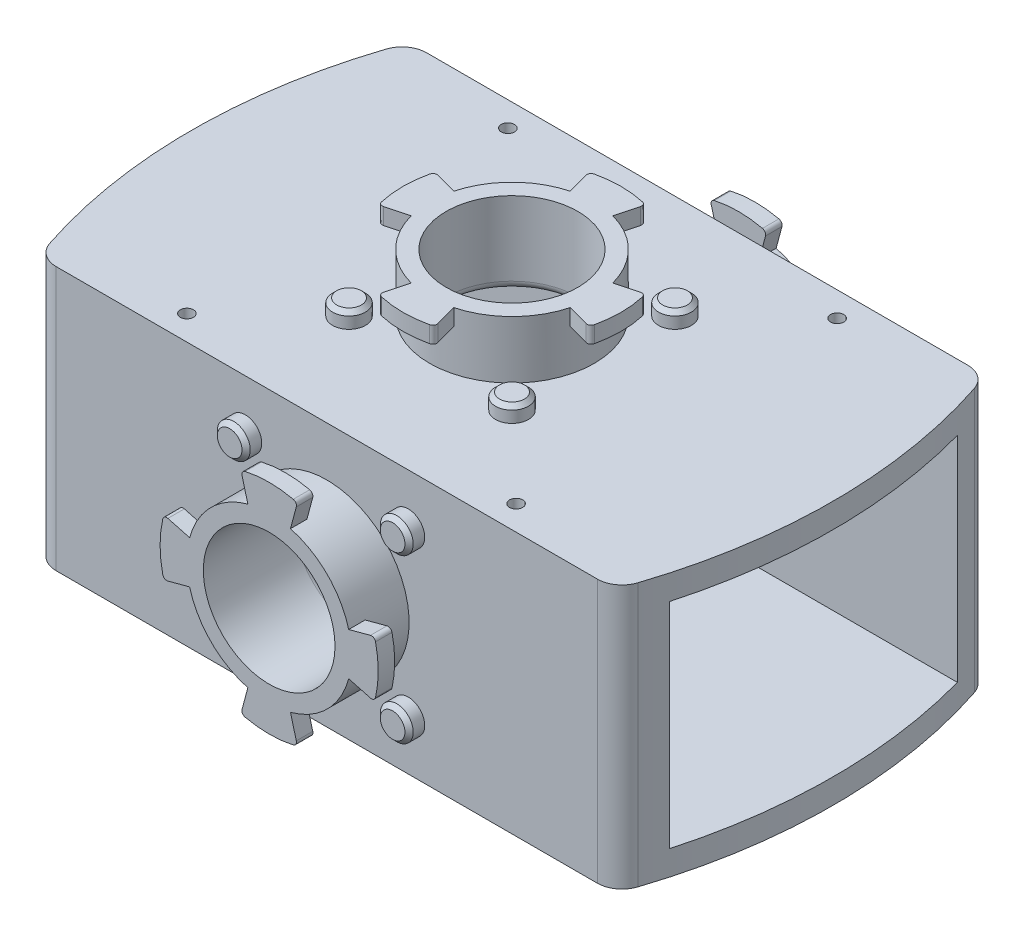
from build123d import *
from build123d.topology import SkipClean

# Parameters (mm, degrees)
EXTRUDE_1_DEPTH                      = 16
SKETCH_3_R                           = 10.000000000000004
SKETCH_3_R_2                         = 8
EXTRUDE_2_DEPTH                      = 7
EXTRUDE_START                        = -2
EXTRUDE_3_DEPTH                      = 2
FILLET_1_R                           = 0.5
PATTERN_CIRCULAR_1_COUNT             = 4
FILLET_1_OF_PATTERN_CIRCULAR_1_R     = 0.5
SKETCH_5_R                           = 1.9999999999999996
EXTRUDE_4_DEPTH                      = 1.9
CHAMFER_1_SIZE                       = 0.5
PATTERN_CIRCULAR_2_COUNT             = 4
CHAMFER_1_OF_PATTERN_CIRCULAR_2_SIZE = 0.5
CUT_EXTRUDE_1_DEPTH                  = 75
MIRROR_START                         = -23
MIRROR_1_OUTLINE_R                   = 10
MIRROR_1_OUTLINE_R_2                 = 8
MIRROR_1_DEPTH                       = 7
MIRROR_1_2_DEPTH                     = 2
CUT_EXTRUDE_START                    = -39
CUT_EXTRUDE_2_OUTLINE_R              = 8
CUT_EXTRUDE_2_DEPTH                  = 32
SKETCH_6_R                           = 10
SKETCH_6_R_2                         = 8
EXTRUDE_5_DEPTH                      = 7
EXTRUDE_6_DEPTH                      = 2
FILLET_2_R                           = 0.5
SKETCH_8_R                           = 2.0000000000000013
EXTRUDE_7_DEPTH                      = 1.9
CHAMFER_2_SIZE                       = 0.5
PATTERN_CIRCULAR_3_COUNT             = 4
FILLET_2_OF_PATTERN_CIRCULAR_3_R     = 0.5
CHAMFER_2_OF_PATTERN_CIRCULAR_3_SIZE = 0.5
MIRROR_START_2                       = -29.5
MIRROR_2_OUTLINE_R                   = 10
MIRROR_2_OUTLINE_R_2                 = 8
MIRROR_2_DEPTH                       = 7.5
MIRROR_2_2_DEPTH                     = 2
FILLET_3_R                           = 3
SKETCH_11_R                          = 8
CUT_EXTRUDE_3_DEPTH                  = 59


with BuildPart() as part:
    # ｽｹｯﾁ2 → ﾎﾞｽ - 押し出し1 (new, symmetric)
    with BuildSketch(Plane(origin=(0, 0, 0), x_dir=(1, 0, 0), z_dir=(0, 1, 0))):
        with BuildLine():
            Line((-35.00000000000001, 22.5), (34.99999999999999, 22.5))
            ThreePointArc((34.99999999999999, 22.5), (39, 0), (34.99999999999999, -22.5))
            Line((34.99999999999999, -22.5), (-35.00000000000001, -22.5))
            ThreePointArc((-35.00000000000001, -22.5), (-39.00000000000001, 7.99e-15), (-35.00000000000001, 22.5))
        make_face()
    extrude(amount=EXTRUDE_1_DEPTH, both=True)

    # ｽｹｯﾁ3 → ﾎﾞｽ - 押し出し2 (add)
    with BuildSketch(Plane(origin=(0, 16, 0), x_dir=(1, 0, 0), z_dir=(0, 1, 0))):
        with Locations(Location((0, 0, 0), (0, 0, 270))):
            Circle(SKETCH_3_R)
        with Locations(Location((0, 0, 0), (0, 0, 270))):
            Circle(SKETCH_3_R_2, mode=Mode.SUBTRACT)
    extrude(amount=EXTRUDE_2_DEPTH)

    # ｽｹｯﾁ4 → ﾎﾞｽ - 押し出し3 (add)
    with BuildSketch(Plane(origin=(0, 23, 0), x_dir=(1, 0, 0), z_dir=(0, 1, 0)).offset(EXTRUDE_START)):
        with BuildLine():
            Line((-3.4293523476083645, 12.798517198330163), (-2.5881904510251803, 9.659258262890692))
            ThreePointArc((-2.5881904510251803, 9.659258262890692), (-1.67e-15, 10.000000000000002), (2.588190451025177, 9.659258262890695))
            Line((2.588190451025176, 9.659258262890694), (3.4293523476083583, 12.798517198330167))
            ThreePointArc((3.429352347608359, 12.798517198330167), (-3.22e-15, 13.249999999999998), (-3.4293523476083645, 12.798517198330163))
        make_face()
    extrude_3 = extrude(amount=EXTRUDE_3_DEPTH)

    # ﾌｨﾚｯﾄ1
    fillet_1_edges = [part.edges().sort_by_distance(p)[0] for p in [
        (-3.429352347608364, 22, -12.798517198330163),
        (3.4293523476083583, 22, -12.798517198330167),
    ]]
    fillet(fillet_1_edges, radius=FILLET_1_R)

    # 円形ﾊﾟﾀｰﾝ1: ﾎﾞｽ - 押し出し3 ×4 about axis
    pattern_circular_1_axis = Axis((9.84e-15, 0, 8e-17), (0, 1, 0))
    for i in range(1, PATTERN_CIRCULAR_1_COUNT):
        add(extrude_3.rotate(pattern_circular_1_axis, i * 360 / PATTERN_CIRCULAR_1_COUNT))

    # ﾌｨﾚｯﾄ1 of 円形ﾊﾟﾀｰﾝ1
    fillet_1_of_pattern_circular_1_edges = [part.edges().sort_by_distance(p)[0] for p in [
        (-12.798517198330154, 22, 3.429352347608373),
        (-12.798517198330158, 22, -3.4293523476083494),
        (3.429352347608382, 22, 12.798517198330163),
        (-3.4293523476083405, 22, 12.798517198330167),
        (12.798517198330174, 22, -3.4293523476083716),
        (12.798517198330178, 22, 3.4293523476083507),
    ]]
    fillet(fillet_1_of_pattern_circular_1_edges, radius=FILLET_1_OF_PATTERN_CIRCULAR_1_R)

    # ｽｹｯﾁ5 → ﾎﾞｽ - 押し出し4 (add)
    with BuildSketch(Plane(origin=(0, 16, 0), x_dir=(1, 0, 0), z_dir=(0, 1, 0))):
        with Locations(Location((-9.89949493661165, 9.899494936611681, 0), (0, 0, 90))):
            Circle(SKETCH_5_R)
    extrude_4 = extrude(amount=EXTRUDE_4_DEPTH)

    # 面取り1
    chamfer_1_edges = [part.edges().sort_by_distance(p)[0] for p in [
        (-9.89949493661165, 17.9, -7.899494936611681),
    ]]
    chamfer(chamfer_1_edges, length=CHAMFER_1_SIZE)

    # 円形ﾊﾟﾀｰﾝ2: ﾎﾞｽ - 押し出し4 ×4 about axis
    pattern_circular_2_axis = Axis((-1.735e-14, 0, 1.735e-14), (0, 1, 0))
    for i in range(1, PATTERN_CIRCULAR_2_COUNT):
        add(extrude_4.rotate(pattern_circular_2_axis, i * 360 / PATTERN_CIRCULAR_2_COUNT))

    # 面取り1 of 円形ﾊﾟﾀｰﾝ2
    chamfer_1_of_pattern_circular_2_edges = [part.edges().sort_by_distance(p)[0] for p in [
        (-7.899494936611717, 17.9, 9.89949493661165),
        (9.899494936611612, 17.9, 7.899494936611717),
        (7.899494936611683, 17.9, -9.899494936611612),
    ]]
    chamfer(chamfer_1_of_pattern_circular_2_edges, length=CHAMFER_1_OF_PATTERN_CIRCULAR_2_SIZE)

    # ｽｹｯﾁ9 → ｶｯﾄ - 押し出し1 (cut, symmetric)
    with BuildSketch(Plane(origin=(0, 0, 0), x_dir=(0, 0, -1), z_dir=(1, 0, 0))):
        Polygon((17.5, -13.000000000000002), (-17.5, -13.000000000000005), (-17.5, 12.999999999999995), (17.5, 12.999999999999998), align=None)
    extrude(amount=CUT_EXTRUDE_1_DEPTH, both=True, mode=Mode.SUBTRACT)

    # ﾐﾗｰ1: read off the stored shape, not the designer's step
    # ﾐﾗｰ1 outline → ﾐﾗｰ1 (add)
    with BuildSketch(Plane(origin=(0, 0, 0), x_dir=(1, 0, 0), z_dir=(0, 1, 0)).offset(MIRROR_START)):
        Circle(MIRROR_1_OUTLINE_R)
        Circle(MIRROR_1_OUTLINE_R_2, mode=Mode.SUBTRACT)
    extrude(amount=MIRROR_1_DEPTH)

    # Mirror 1 2 outline → Mirror 1 2 (add)
    with BuildSketch(Plane(origin=(0, 0, 0), x_dir=(1, 0, 0), z_dir=(0, 1, 0)).offset(MIRROR_START)):
        with BuildLine():
            ThreePointArc((9.659258263, 2.588190451), (10, 0), (9.659258263, -2.588190451))
            Line((9.659258263, -2.588190451), (12.30608078, -3.297404407))
            ThreePointArc((12.30608078, -3.297404407), (12.693934299, -3.242468012), (12.923156589, -2.924811749))
            ThreePointArc((12.923156589, -2.924811749), (13.25, 0), (12.923156589, 2.924811749))
            ThreePointArc((12.923156589, 2.924811749), (12.693934299, 3.242468012), (12.30608078, 3.297404407))
            Line((12.30608078, 3.297404407), (9.659258263, 2.588190451))
        make_face()
        with BuildLine():
            ThreePointArc((-2.588190451, 9.659258263), (0, 10), (2.588190451, 9.659258263))
            Line((2.588190451, 9.659258263), (3.297404407, 12.30608078))
            ThreePointArc((3.297404407, 12.30608078), (3.242468012, 12.693934299), (2.924811749, 12.923156589))
            ThreePointArc((2.924811749, 12.923156589), (0, 13.25), (-2.924811749, 12.923156589))
            ThreePointArc((-2.924811749, 12.923156589), (-3.242468012, 12.693934299), (-3.297404407, 12.30608078))
            Line((-3.297404407, 12.30608078), (-2.588190451, 9.659258263))
        make_face()
        with BuildLine():
            Line((3.297404407, -12.30608078), (2.588190451, -9.659258263))
            ThreePointArc((2.588190451, -9.659258263), (0, -10), (-2.588190451, -9.659258263))
            Line((-2.588190451, -9.659258263), (-3.297404407, -12.30608078))
            ThreePointArc((-3.297404407, -12.30608078), (-3.242468012, -12.693934299), (-2.924811749, -12.923156589))
            ThreePointArc((-2.924811749, -12.923156589), (0, -13.25), (2.924811749, -12.923156589))
            ThreePointArc((2.924811749, -12.923156589), (3.242468012, -12.693934299), (3.297404407, -12.30608078))
        make_face()
        with BuildLine():
            ThreePointArc((-9.659258263, -2.588190451), (-10, 0), (-9.659258263, 2.588190451))
            Line((-9.659258263, 2.588190451), (-12.30608078, 3.297404407))
            ThreePointArc((-12.30608078, 3.297404407), (-12.693934299, 3.242468012), (-12.923156589, 2.924811749))
            ThreePointArc((-12.923156589, 2.924811749), (-13.25, 0), (-12.923156589, -2.924811749))
            ThreePointArc((-12.923156589, -2.924811749), (-12.693934299, -3.242468012), (-12.30608078, -3.297404407))
            Line((-12.30608078, -3.297404407), (-9.659258263, -2.588190451))
        make_face()
    extrude(amount=MIRROR_1_2_DEPTH)

    # Mirror 1 3 outline → Mirror 1 3 (revolve)
    with BuildSketch(Plane(origin=(-9.899494937, 0, -9.899494937), x_dir=(1, 0, 0), z_dir=(0, 0, 1))):
        Polygon((1.5, -17.9), (2, -17.4), (2, -16), (0, -16), (0, -17.9), align=None)
    revolve(axis=Axis((-9.899494937, 0, -9.899494937), (0, 1, 0)))

    # Mirror 1 4 outline → Mirror 1 4 (revolve)
    with BuildSketch(Plane(origin=(-9.899494937, 0, 9.899494937), x_dir=(1, 0, 0), z_dir=(0, 0, 1))):
        Polygon((1.5, -17.9), (2, -17.4), (2, -16), (0, -16), (0, -17.9), align=None)
    revolve(axis=Axis((-9.899494937, 0, 9.899494937), (0, 1, 0)))

    # Mirror 1 5 outline → Mirror 1 5 (revolve)
    with BuildSketch(Plane(origin=(9.899494937, 0, 9.899494937), x_dir=(1, 0, 0), z_dir=(0, 0, 1))):
        Polygon((1.5, -17.9), (2, -17.4), (2, -16), (0, -16), (0, -17.9), align=None)
    revolve(axis=Axis((9.899494937, 0, 9.899494937), (0, 1, 0)))

    # Mirror 1 6 outline → Mirror 1 6 (revolve)
    with BuildSketch(Plane(origin=(9.899494937, 0, -9.899494937), x_dir=(1, 0, 0), z_dir=(0, 0, 1))):
        Polygon((1.5, -17.9), (2, -17.4), (2, -16), (0, -16), (0, -17.9), align=None)
    revolve(axis=Axis((9.899494937, 0, -9.899494937), (0, 1, 0)))

    # ｶｯﾄ - 押し出し2: read off the stored shape, not the designer's step
    # ｶｯﾄ - 押し出し2 outline → ｶｯﾄ - 押し出し2 (cut)
    with BuildSketch(Plane(origin=(0, 23, 0), x_dir=(1, 0, 0), z_dir=(0, 1, 0)).offset(CUT_EXTRUDE_START)):
        Circle(CUT_EXTRUDE_2_OUTLINE_R)
    extrude(amount=CUT_EXTRUDE_2_DEPTH, mode=Mode.SUBTRACT)

    # ｽｹｯﾁ6 → ﾎﾞｽ - 押し出し5 (add)
    with BuildSketch(Plane.XY.offset(22.5)):
        with Locations(Location((0, 0, 0), (0, 0, 180))):
            Circle(SKETCH_6_R)
        Circle(SKETCH_6_R_2, mode=Mode.SUBTRACT)
    extrude(amount=EXTRUDE_5_DEPTH)

    # ｽｹｯﾁ7 → ﾎﾞｽ - 押し出し6 (add)
    with BuildSketch(Plane.XY.offset(29.5).offset(EXTRUDE_START)):
        with BuildLine():
            Line((-3.429352347608455, 12.798517198330138), (-2.070552360820199, 7.727406610312537))
            ThreePointArc((-2.070552360820199, 7.727406610312537), (-5.991e-14, 7.999999999999999), (2.0705523608200846, 7.727406610312568))
            Line((2.0705523608200846, 7.727406610312568), (3.4293523476082672, 12.798517198330192))
            ThreePointArc((3.4293523476082672, 12.798517198330192), (-9.922e-14, 13.249999999999998), (-3.429352347608455, 12.798517198330138))
        make_face()
    extrude_6 = extrude(amount=EXTRUDE_6_DEPTH)

    # ﾌｨﾚｯﾄ2
    fillet_2_edges = [part.edges().sort_by_distance(p)[0] for p in [
        (3.4293523476082672, 12.798517198330192, 28.5),
        (-3.4293523476084555, 12.798517198330138, 28.5),
    ]]
    fillet(fillet_2_edges, radius=FILLET_2_R)

    # ｽｹｯﾁ8 → ﾎﾞｽ - 押し出し7 (add)
    with BuildSketch(Plane.XY.offset(22.5)):
        with Locations(Location((-9.899494936611719, 9.89949493661161, 0), (0, 0, 180))):
            Circle(SKETCH_8_R)
    extrude_7 = extrude(amount=EXTRUDE_7_DEPTH)

    # 面取り2
    chamfer_2_edges = [part.edges().sort_by_distance(p)[0] for p in [
        (-7.899494936611717, 9.89949493661161, 24.4),
    ]]
    chamfer(chamfer_2_edges, length=CHAMFER_2_SIZE)

    # 円形ﾊﾟﾀｰﾝ3: ﾎﾞｽ - 押し出し6, ﾎﾞｽ - 押し出し7 ×4 about axis
    with SkipClean():  # the faces are left unmerged after this step: merging them gives an invalid solid
        pattern_circular_3_axis = Axis((-1.211e-14, -6.29e-15, 0), (0, 0, 1))
        add([extrude_6.rotate(pattern_circular_3_axis, i * 360 / PATTERN_CIRCULAR_3_COUNT) for i in range(1, PATTERN_CIRCULAR_3_COUNT)])
        add([extrude_7.rotate(pattern_circular_3_axis, i * 360 / PATTERN_CIRCULAR_3_COUNT) for i in range(1, PATTERN_CIRCULAR_3_COUNT)])

    # ﾌｨﾚｯﾄ2 of 円形ﾊﾟﾀｰﾝ3
    fillet_2_of_pattern_circular_3_edges = [part.edges().sort_by_distance(p)[0] for p in [
        (-12.79851719833021, 3.429352347608274, 28.5),
        (-12.798517198330156, -3.429352347608449, 28.5),
        (-3.4293523476082934, -12.798517198330204, 28.5),
        (3.4293523476084293, -12.798517198330151, 28.5),
        (12.798517198330186, -3.4293523476082877, 28.5),
        (12.798517198330133, 3.429352347608435, 28.5),
    ]]
    fillet(fillet_2_of_pattern_circular_3_edges, radius=FILLET_2_OF_PATTERN_CIRCULAR_3_R)

    # 面取り2 of 円形ﾊﾟﾀｰﾝ3
    chamfer_2_of_pattern_circular_3_edges = [part.edges().sort_by_distance(p)[0] for p in [
        (-9.899494936611628, -7.89949493661171, 24.4),
        (7.899494936611692, -9.899494936611624, 24.4),
        (9.899494936611607, 7.899494936611696, 24.4),
    ]]
    chamfer(chamfer_2_of_pattern_circular_3_edges, length=CHAMFER_2_OF_PATTERN_CIRCULAR_3_SIZE)

    # ﾐﾗｰ2: read off the stored shape, not the designer's step
    # ﾐﾗｰ2 outline → ﾐﾗｰ2 (add)
    with SkipClean():  # the faces are left unmerged after this step: merging them gives an invalid solid
        with BuildSketch(Plane.XY.offset(MIRROR_START_2)):
            Circle(MIRROR_2_OUTLINE_R)
            Circle(MIRROR_2_OUTLINE_R_2, mode=Mode.SUBTRACT)
        extrude(amount=MIRROR_2_DEPTH)

    # Mirror 2 2 outline → Mirror 2 2 (add)
    with SkipClean():  # the faces are left unmerged after this step: merging them gives an invalid solid
        with BuildSketch(Plane.XY.offset(MIRROR_START_2)):
            with BuildLine():
                ThreePointArc((9.659258263, 2.588190451), (10, 0), (9.659258263, -2.588190451))
                Line((9.659258263, -2.588190451), (12.30608078, -3.297404407))
                ThreePointArc((12.30608078, -3.297404407), (12.693934299, -3.242468012), (12.923156589, -2.924811749))
                ThreePointArc((12.923156589, -2.924811749), (13.25, 0), (12.923156589, 2.924811749))
                ThreePointArc((12.923156589, 2.924811749), (12.693934299, 3.242468012), (12.30608078, 3.297404407))
                Line((12.30608078, 3.297404407), (9.659258263, 2.588190451))
            make_face()
            with BuildLine():
                ThreePointArc((-2.588190451, 9.659258263), (0, 10), (2.588190451, 9.659258263))
                Line((2.588190451, 9.659258263), (3.297404407, 12.30608078))
                ThreePointArc((3.297404407, 12.30608078), (3.242468012, 12.693934299), (2.924811749, 12.923156589))
                ThreePointArc((2.924811749, 12.923156589), (0, 13.25), (-2.924811749, 12.923156589))
                ThreePointArc((-2.924811749, 12.923156589), (-3.242468012, 12.693934299), (-3.297404407, 12.30608078))
                Line((-3.297404407, 12.30608078), (-2.588190451, 9.659258263))
            make_face()
            with BuildLine():
                Line((3.297404407, -12.30608078), (2.588190451, -9.659258263))
                ThreePointArc((2.588190451, -9.659258263), (0, -10), (-2.588190451, -9.659258263))
                Line((-2.588190451, -9.659258263), (-3.297404407, -12.30608078))
                ThreePointArc((-3.297404407, -12.30608078), (-3.242468012, -12.693934299), (-2.924811749, -12.923156589))
                ThreePointArc((-2.924811749, -12.923156589), (0, -13.25), (2.924811749, -12.923156589))
                ThreePointArc((2.924811749, -12.923156589), (3.242468012, -12.693934299), (3.297404407, -12.30608078))
            make_face()
            with BuildLine():
                ThreePointArc((-9.659258263, -2.588190451), (-10, 0), (-9.659258263, 2.588190451))
                Line((-9.659258263, 2.588190451), (-12.30608078, 3.297404407))
                ThreePointArc((-12.30608078, 3.297404407), (-12.693934299, 3.242468012), (-12.923156589, 2.924811749))
                ThreePointArc((-12.923156589, 2.924811749), (-13.25, 0), (-12.923156589, -2.924811749))
                ThreePointArc((-12.923156589, -2.924811749), (-12.693934299, -3.242468012), (-12.30608078, -3.297404407))
                Line((-12.30608078, -3.297404407), (-9.659258263, -2.588190451))
            make_face()
        extrude(amount=MIRROR_2_2_DEPTH)

    # Mirror 2 3 outline → Mirror 2 3 (revolve)
    with SkipClean():  # the faces are left unmerged after this step: merging them gives an invalid solid
        with BuildSketch(Plane(origin=(-9.899494937, 9.899494937, 0), x_dir=(1, 0, 0), z_dir=(0, -1, 0))):
            Polygon((1.5, -24.4), (2, -23.9), (2, -22.5), (0, -22.5), (0, -24.4), align=None)
        revolve(axis=Axis((-9.899494937, 9.899494937, 0), (0, 0, 1)))

    # Mirror 2 4 outline → Mirror 2 4 (revolve)
    with SkipClean():  # the faces are left unmerged after this step: merging them gives an invalid solid
        with BuildSketch(Plane(origin=(-9.899494937, -9.899494937, 0), x_dir=(1, 0, 0), z_dir=(0, -1, 0))):
            Polygon((1.5, -24.4), (2, -23.9), (2, -22.5), (0, -22.5), (0, -24.4), align=None)
        revolve(axis=Axis((-9.899494937, -9.899494937, 0), (0, 0, 1)))

    # Mirror 2 5 outline → Mirror 2 5 (revolve)
    with SkipClean():  # the faces are left unmerged after this step: merging them gives an invalid solid
        with BuildSketch(Plane(origin=(9.899494937, -9.899494937, 0), x_dir=(1, 0, 0), z_dir=(0, -1, 0))):
            Polygon((1.5, -24.4), (2, -23.9), (2, -22.5), (0, -22.5), (0, -24.4), align=None)
        revolve(axis=Axis((9.899494937, -9.899494937, 0), (0, 0, 1)))

    # Mirror 2 6 outline → Mirror 2 6 (revolve)
    with SkipClean():  # the faces are left unmerged after this step: merging them gives an invalid solid
        with BuildSketch(Plane(origin=(9.899494937, 9.899494937, 0), x_dir=(1, 0, 0), z_dir=(0, -1, 0))):
            Polygon((1.5, -24.4), (2, -23.9), (2, -22.5), (0, -22.5), (0, -24.4), align=None)
        revolve(axis=Axis((9.899494937, 9.899494937, 0), (0, 0, 1)))

    # ﾌｨﾚｯﾄ3
    fillet_3_edges = [part.edges().sort_by_distance(p)[0] for p in [
        (-35.000000000000014, 0, -22.5),
        (34.99999999999999, 0, -22.5),
        (34.999999999999986, 0, 22.500000000000007),
        (-35.000000000000014, 0, 22.5),
    ]]
    fillet(fillet_3_edges, radius=FILLET_3_R)

    # ｽｹｯﾁ11 → ｶｯﾄ - 押し出し3 (cut)
    with SkipClean():  # the faces are left unmerged after this step: merging them gives an invalid solid
        with BuildSketch(Plane(origin=(0, 0, -29.5), x_dir=(-1, 0, 0), z_dir=(0, 0, -1))):
            with Locations(Location((0, 0, 0), (0, 0, 180))):
                Circle(SKETCH_11_R)
        extrude(amount=-CUT_EXTRUDE_3_DEPTH, mode=Mode.SUBTRACT)

    # ｽｹｯﾁ16 → M2 ねじ穴1 (revolve, cut)
    with SkipClean():  # the faces are left unmerged after this step: merging them gives an invalid solid
        with BuildSketch(Plane(origin=(-20, 16, -19.5), x_dir=(0, 0, 1), z_dir=(1, 0, 0))):
            Polygon((0, 0), (-1.59e-15, 6.480688495222049), (0.7999999999999984, 6), (0.799999999999999, -1e-17), align=None)
        hole_wizard_m2_1 = revolve(axis=Axis((-20, 22.34999999999999, -19.5), (0, -1, 0)), mode=Mode.SUBTRACT)

    # ﾐﾗｰ3: M2 ねじ穴1 across plane
    with SkipClean():  # the faces are left unmerged after this step: merging them gives an invalid solid
        add(hole_wizard_m2_1.mirror(Plane(origin=(0, 0, 0), x_dir=(0, 0, 1), z_dir=(1, 0, 0))), mode=Mode.SUBTRACT)

    # ﾐﾗｰ4: M2 ねじ穴1 across plane
    with SkipClean():  # the faces are left unmerged after this step: merging them gives an invalid solid
        add(hole_wizard_m2_1.mirror(Plane.XY), mode=Mode.SUBTRACT)

    # ﾐﾗｰ4 copy 1 sketch → ﾐﾗｰ4 copy 1 (revolve, cut)
    with SkipClean():  # the faces are left unmerged after this step: merging them gives an invalid solid
        with BuildSketch(Plane(origin=(20, 16, 19.5), x_dir=(0, 0, -1), z_dir=(-1, 0, 0))):
            Polygon((0, 0), (-1.59e-15, 6.480688495222049), (0.7999999999999984, 6), (0.799999999999999, -1e-17), align=None)
        revolve(axis=Axis((20, 22.34999999999999, 19.5), (0, -1, 0)), mode=Mode.SUBTRACT)

    # ﾐﾗｰ5: M2 ねじ穴1 across plane
    with SkipClean():  # the faces are left unmerged after this step: merging them gives an invalid solid
        add(hole_wizard_m2_1.mirror(Plane.ZX), mode=Mode.SUBTRACT)

    # ﾐﾗｰ5 copy 1 sketch → ﾐﾗｰ5 copy 1 (revolve, cut)
    with SkipClean():  # the faces are left unmerged after this step: merging them gives an invalid solid
        with BuildSketch(Plane(origin=(20, -16, -19.5), x_dir=(0, 0, 1), z_dir=(-1, 0, 0))):
            Polygon((0, 0), (-1.59e-15, 6.480688495222049), (0.7999999999999984, 6), (0.799999999999999, -1e-17), align=None)
        revolve(axis=Axis((20, -22.34999999999999, -19.5), (0, 1, 0)), mode=Mode.SUBTRACT)

    # ﾐﾗｰ5 copy 2 sketch → ﾐﾗｰ5 copy 2 (revolve, cut)
    with SkipClean():  # the faces are left unmerged after this step: merging them gives an invalid solid
        with BuildSketch(Plane(origin=(-20, -16, 19.5), x_dir=(0, 0, -1), z_dir=(1, 0, 0))):
            Polygon((0, 0), (-1.59e-15, 6.480688495222049), (0.7999999999999984, 6), (0.799999999999999, -1e-17), align=None)
        revolve(axis=Axis((-20, -22.34999999999999, 19.5), (0, 1, 0)), mode=Mode.SUBTRACT)

    # ﾐﾗｰ5 copy 3 sketch → ﾐﾗｰ5 copy 3 (revolve, cut)
    with SkipClean():  # the faces are left unmerged after this step: merging them gives an invalid solid
        with BuildSketch(Plane(origin=(20, -16, 19.5), x_dir=(0, 0, -1), z_dir=(-1, 0, 0))):
            Polygon((0, 0), (-1.59e-15, -6.480688495222049), (0.7999999999999984, -6), (0.799999999999999, 1e-17), align=None)
        revolve(axis=Axis((20, -22.34999999999999, 19.5), (0, -1, 0)), mode=Mode.SUBTRACT)

    # ﾌｨﾚｯﾄ4: read off the stored shape, not the designer's step
    # ﾌｨﾚｯﾄ4 outline → ﾌｨﾚｯﾄ4 (revolve, cut)
    with SkipClean():  # the faces are left unmerged after this step: merging them gives an invalid solid
        with BuildSketch(Plane.XZ):
            with BuildLine():
                ThreePointArc((9, 17.5), (8.292893219, 17.792893219), (8, 18.5))
                Line((8, 18.5), (8, 17.5))
                Line((8, 17.5), (9, 17.5))
            make_face()
            with BuildLine():
                ThreePointArc((8, -18.5), (8.292893219, -17.792893219), (9, -17.5))
                Line((9, -17.5), (8, -17.5))
                Line((8, -17.5), (8, -18.5))
            make_face()
        revolve(axis=Axis((0, 0, 0), (0, 0, 1)), mode=Mode.SUBTRACT)

    # Fillet 4 2 outline → Fillet 4 2 (revolve, cut)
    with SkipClean():  # the faces are left unmerged after this step: merging them gives an invalid solid
        with BuildSketch(Plane.XY):
            with BuildLine():
                Line((8, -13), (8, -14))
                ThreePointArc((8, -14), (8.292893219, -13.292893219), (9, -13))
                Line((9, -13), (8, -13))
            make_face()
            with BuildLine():
                Line((8, 13), (9, 13))
                ThreePointArc((9, 13), (8.292893219, 13.292893219), (8, 14))
                Line((8, 14), (8, 13))
            make_face()
        revolve(axis=Axis((0, 0, 0), (0, 1, 0)), mode=Mode.SUBTRACT)


solid = part.part
